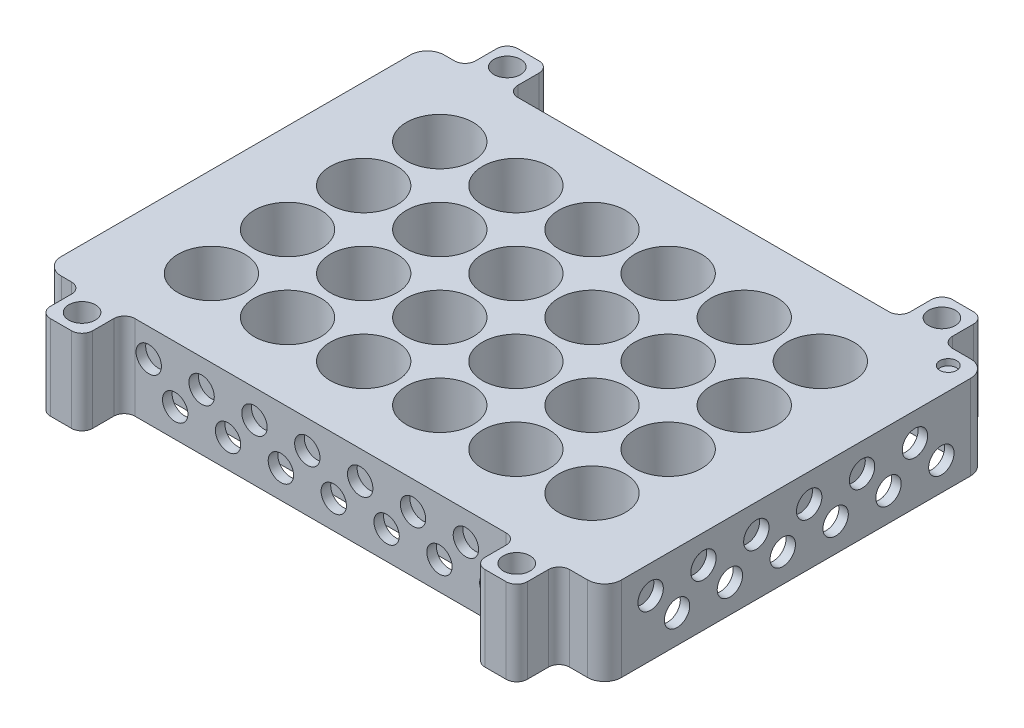
from build123d import *

# Parameters (mm, degrees)
SKETCH1_W           = 157.0786
SKETCH1_H           = 90.551
BOSS_EXTRUDE1_DEPTH = 24.5
CUT_EXTRUDE30_DEPTH = 24.5
CUT_EXTRUDE5_START  = -24.5
SKETCH7_R           = 7.895
CUT_EXTRUDE5_DEPTH  = 17
SKETCH23_W          = 128.6429
SKETCH23_H          = 86.72376579
SKETCH23_W_2        = 110.8429
SKETCH23_H_2        = 74.72376579
CUT_EXTRUDE21_DEPTH = 4.5
FILLET7_R           = 1
FILLET8_R           = 2.75
SKETCH26_W          = 115.8718073
SKETCH26_H          = 74.72376579
CUT_EXTRUDE22_DEPTH = 3
SKETCH29_W          = 12.30424
SKETCH29_H          = 90.551
CUT_EXTRUDE25_DEPTH = 183.957427231
FILLET9_R           = 4
SKETCH30_W          = 10
SKETCH30_H          = 10
BOSS_EXTRUDE2_DEPTH = 24.5
SKETCH31_R          = 3.15
CUT_EXTRUDE26_DEPTH = 178.961706315
FILLET10_R          = 2.5
SKETCH35_R          = 1.4
BOSS_EXTRUDE3_DEPTH = 0.75
SKETCH37_W          = 236.034585018
SKETCH37_H          = 147.923412956
CUT_EXTRUDE29_DEPTH = 4.5
SKETCH36_W          = 128
SKETCH36_H          = 85.994841346
SKETCH36_W_2        = 110.5
SKETCH36_H_2        = 75.89132888
CUT_EXTRUDE28_DEPTH = 17
FILLET11_R          = 4
FILLET12_R          = 4
SKETCH43_R          = 2
CUT_EXTRUDE32_DEPTH = 1.5
SKETCH44_R          = 3
CUT_EXTRUDE33_DEPTH = 2.23506
SKETCH45_R          = 3
CUT_EXTRUDE34_DEPTH = 2.278079327
CUT_EXTRUDE35_START = -2.23506
SKETCH46_R          = 3
CUT_EXTRUDE35_DEPTH = 2.23506
SKETCH47_R          = 3
CUT_EXTRUDE36_DEPTH = 2.278079327


with BuildPart() as part:
    # Sketch1 → Boss-Extrude1 (new body)
    with BuildSketch(Plane(origin=(0, 0, 0), x_dir=(1, 0, 0), z_dir=(0, 1, 0))):
        with Locations((78.5393, -45.2755)):
            Rectangle(SKETCH1_W, SKETCH1_H)
    extrude(amount=BOSS_EXTRUDE1_DEPTH)

    # Sketch39 → Cut-Extrude30 (cut)
    with BuildSketch(Plane(origin=(0, 24.5, 0), x_dir=(1, 0, 0), z_dir=(0, 1, 0))):
        Polygon((36.7043, -11.5955), (36.7043, -17.9255), (30.3743, -17.9255), (30.3743, -12.10434), (30.88314, -11.5955), align=None)
        Polygon((36.7043, -18.6255), (36.7043, -24.9555), (30.3743, -24.9555), (30.3743, -19.13434), (30.88314, -18.6255), align=None)
        Polygon((54.7043, -11.5955), (54.7043, -17.9255), (48.3743, -17.9255), (48.3743, -12.10434), (48.88314, -11.5955), align=None)
        Polygon((72.7043, -11.5955), (72.7043, -17.9255), (66.3743, -17.9255), (66.3743, -12.10434), (66.88314, -11.5955), align=None)
        Polygon((90.7043, -11.5955), (90.7043, -17.9255), (84.3743, -17.9255), (84.3743, -12.10434), (84.88314, -11.5955), align=None)
        Polygon((108.7043, -11.5955), (108.7043, -17.9255), (102.3743, -17.9255), (102.3743, -12.10434), (102.88314, -11.5955), align=None)
        Polygon((126.7043, -11.5955), (126.7043, -17.9255), (120.3743, -17.9255), (120.3743, -12.10434), (120.88314, -11.5955), align=None)
        Polygon((54.7043, -29.5955), (54.7043, -35.9255), (48.3743, -35.9255), (48.3743, -30.10434), (48.88314, -29.5955), align=None)
        Polygon((72.7043, -29.5955), (72.7043, -35.9255), (66.3743, -35.9255), (66.3743, -30.10434), (66.88314, -29.5955), align=None)
        Polygon((90.7043, -29.5955), (90.7043, -35.9255), (84.3743, -35.9255), (84.3743, -30.10434), (84.88314, -29.5955), align=None)
        Polygon((108.7043, -29.5955), (108.7043, -35.9255), (102.3743, -35.9255), (102.3743, -30.10434), (102.88314, -29.5955), align=None)
        Polygon((126.7043, -29.5955), (126.7043, -35.9255), (120.3743, -35.9255), (120.3743, -30.10434), (120.88314, -29.5955), align=None)
        Polygon((54.7043, -47.5955), (54.7043, -53.9255), (48.3743, -53.9255), (48.3743, -48.10434), (48.88314, -47.5955), align=None)
        Polygon((72.7043, -47.5955), (72.7043, -53.9255), (66.3743, -53.9255), (66.3743, -48.10434), (66.88314, -47.5955), align=None)
        Polygon((90.7043, -47.5955), (90.7043, -53.9255), (84.3743, -53.9255), (84.3743, -48.10434), (84.88314, -47.5955), align=None)
        Polygon((108.7043, -47.5955), (108.7043, -53.9255), (102.3743, -53.9255), (102.3743, -48.10434), (102.88314, -47.5955), align=None)
        Polygon((126.7043, -47.5955), (126.7043, -53.9255), (120.3743, -53.9255), (120.3743, -48.10434), (120.88314, -47.5955), align=None)
        Polygon((54.7043, -65.5955), (54.7043, -71.9255), (48.3743, -71.9255), (48.3743, -66.10434), (48.88314, -65.5955), align=None)
        Polygon((72.7043, -65.5955), (72.7043, -71.9255), (66.3743, -71.9255), (66.3743, -66.10434), (66.88314, -65.5955), align=None)
        Polygon((90.7043, -65.5955), (90.7043, -71.9255), (84.3743, -71.9255), (84.3743, -66.10434), (84.88314, -65.5955), align=None)
        Polygon((108.7043, -65.5955), (108.7043, -71.9255), (102.3743, -71.9255), (102.3743, -66.10434), (102.88314, -65.5955), align=None)
        Polygon((126.7043, -65.5955), (126.7043, -71.9255), (120.3743, -71.9255), (120.3743, -66.10434), (120.88314, -65.5955), align=None)
        Polygon((36.7043, -29.5955), (36.7043, -35.9255), (30.3743, -35.9255), (30.3743, -30.10434), (30.88314, -29.5955), align=None)
        Polygon((36.7043, -47.5955), (36.7043, -53.9255), (30.3743, -53.9255), (30.3743, -48.10434), (30.88314, -47.5955), align=None)
        Polygon((36.7043, -65.5955), (36.7043, -71.9255), (30.3743, -71.9255), (30.3743, -66.10434), (30.88314, -65.5955), align=None)
        Polygon((54.7043, -18.6255), (54.7043, -24.9555), (48.3743, -24.9555), (48.3743, -19.13434), (48.88314, -18.6255), align=None)
        Polygon((72.7043, -18.6255), (72.7043, -24.9555), (66.3743, -24.9555), (66.3743, -19.13434), (66.88314, -18.6255), align=None)
        Polygon((90.7043, -18.6255), (90.7043, -24.9555), (84.3743, -24.9555), (84.3743, -19.13434), (84.88314, -18.6255), align=None)
        Polygon((108.7043, -18.6255), (108.7043, -24.9555), (102.3743, -24.9555), (102.3743, -19.13434), (102.88314, -18.6255), align=None)
        Polygon((126.7043, -18.6255), (126.7043, -24.9555), (120.3743, -24.9555), (120.3743, -19.13434), (120.88314, -18.6255), align=None)
        Polygon((54.7043, -36.6255), (54.7043, -42.9555), (48.3743, -42.9555), (48.3743, -37.13434), (48.88314, -36.6255), align=None)
        Polygon((72.7043, -36.6255), (72.7043, -42.9555), (66.3743, -42.9555), (66.3743, -37.13434), (66.88314, -36.6255), align=None)
        Polygon((90.7043, -36.6255), (90.7043, -42.9555), (84.3743, -42.9555), (84.3743, -37.13434), (84.88314, -36.6255), align=None)
        Polygon((108.7043, -36.6255), (108.7043, -42.9555), (102.3743, -42.9555), (102.3743, -37.13434), (102.88314, -36.6255), align=None)
        Polygon((126.7043, -36.6255), (126.7043, -42.9555), (120.3743, -42.9555), (120.3743, -37.13434), (120.88314, -36.6255), align=None)
        Polygon((54.7043, -54.6255), (54.7043, -60.9555), (48.3743, -60.9555), (48.3743, -55.13434), (48.88314, -54.6255), align=None)
        Polygon((72.7043, -54.6255), (72.7043, -60.9555), (66.3743, -60.9555), (66.3743, -55.13434), (66.88314, -54.6255), align=None)
        Polygon((90.7043, -54.6255), (90.7043, -60.9555), (84.3743, -60.9555), (84.3743, -55.13434), (84.88314, -54.6255), align=None)
        Polygon((108.7043, -54.6255), (108.7043, -60.9555), (102.3743, -60.9555), (102.3743, -55.13434), (102.88314, -54.6255), align=None)
        Polygon((126.7043, -54.6255), (126.7043, -60.9555), (120.3743, -60.9555), (120.3743, -55.13434), (120.88314, -54.6255), align=None)
        Polygon((54.7043, -72.6255), (54.7043, -78.9555), (48.3743, -78.9555), (48.3743, -73.13434), (48.88314, -72.6255), align=None)
        Polygon((72.7043, -72.6255), (72.7043, -78.9555), (66.3743, -78.9555), (66.3743, -73.13434), (66.88314, -72.6255), align=None)
        Polygon((90.7043, -72.6255), (90.7043, -78.9555), (84.3743, -78.9555), (84.3743, -73.13434), (84.88314, -72.6255), align=None)
        Polygon((108.7043, -72.6255), (108.7043, -78.9555), (102.3743, -78.9555), (102.3743, -73.13434), (102.88314, -72.6255), align=None)
        Polygon((126.7043, -72.6255), (126.7043, -78.9555), (120.3743, -78.9555), (120.3743, -73.13434), (120.88314, -72.6255), align=None)
        Polygon((36.7043, -36.6255), (36.7043, -42.9555), (30.3743, -42.9555), (30.3743, -37.13434), (30.88314, -36.6255), align=None)
        Polygon((36.7043, -54.6255), (36.7043, -60.9555), (30.3743, -60.9555), (30.3743, -55.13434), (30.88314, -54.6255), align=None)
        Polygon((36.7043, -72.6255), (36.7043, -78.9555), (30.3743, -78.9555), (30.3743, -73.13434), (30.88314, -72.6255), align=None)
    extrude(amount=-CUT_EXTRUDE30_DEPTH, mode=Mode.SUBTRACT)

    # Sketch7 → Cut-Extrude5 (cut)
    with BuildSketch(Plane.XZ.offset(CUT_EXTRUDE5_START)):
        with Locations(Location((33.5393, 72.2755, 0), (0, 0, 90))):
            Circle(SKETCH7_R)
        with Locations(Location((51.5393, 72.2755, 0), (0, 0, 90))):
            Circle(SKETCH7_R)
        with Locations(Location((69.5393, 72.2755, 0), (0, 0, 90))):
            Circle(SKETCH7_R)
        with Locations(Location((87.5393, 72.2755, 0), (0, 0, 90))):
            Circle(SKETCH7_R)
        with Locations(Location((105.5393, 72.2755, 0), (0, 0, 90))):
            Circle(SKETCH7_R)
        with Locations(Location((123.5393, 72.2755, 0), (0, 0, 90))):
            Circle(SKETCH7_R)
        with Locations(Location((51.5393, 54.2755, 0), (0, 0, 90))):
            Circle(SKETCH7_R)
        with Locations(Location((69.5393, 54.2755, 0), (0, 0, 90))):
            Circle(SKETCH7_R)
        with Locations(Location((87.5393, 54.2755, 0), (0, 0, 90))):
            Circle(SKETCH7_R)
        with Locations(Location((105.5393, 54.2755, 0), (0, 0, 90))):
            Circle(SKETCH7_R)
        with Locations(Location((123.5393, 54.2755, 0), (0, 0, 90))):
            Circle(SKETCH7_R)
        with Locations(Location((51.5393, 36.2755, 0), (0, 0, 90))):
            Circle(SKETCH7_R)
        with Locations(Location((69.5393, 36.2755, 0), (0, 0, 90))):
            Circle(SKETCH7_R)
        with Locations(Location((87.5393, 36.2755, 0), (0, 0, 90))):
            Circle(SKETCH7_R)
        with Locations(Location((105.5393, 36.2755, 0), (0, 0, 90))):
            Circle(SKETCH7_R)
        with Locations(Location((123.5393, 36.2755, 0), (0, 0, 90))):
            Circle(SKETCH7_R)
        with Locations(Location((51.5393, 18.2755, 0), (0, 0, 90))):
            Circle(SKETCH7_R)
        with Locations(Location((69.5393, 18.2755, 0), (0, 0, 90))):
            Circle(SKETCH7_R)
        with Locations(Location((87.5393, 18.2755, 0), (0, 0, 90))):
            Circle(SKETCH7_R)
        with Locations(Location((105.5393, 18.2755, 0), (0, 0, 90))):
            Circle(SKETCH7_R)
        with Locations(Location((123.5393, 18.2755, 0), (0, 0, 90))):
            Circle(SKETCH7_R)
        with Locations(Location((33.5393, 54.2755, 0), (0, 0, 90))):
            Circle(SKETCH7_R)
        with Locations(Location((33.5393, 36.2755, 0), (0, 0, 90))):
            Circle(SKETCH7_R)
        with Locations(Location((33.5393, 18.2755, 0), (0, 0, 90))):
            Circle(SKETCH7_R)
    extrude(amount=CUT_EXTRUDE5_DEPTH, mode=Mode.SUBTRACT)

    # Sketch23 → Cut-Extrude21 (cut)
    with BuildSketch(Plane(origin=(0, 24.5, 0), x_dir=(1, 0, 0), z_dir=(0, 1, 0))):
        with Locations((78.5393, -45.275497105)):
            Rectangle(SKETCH23_W, SKETCH23_H)
        with Locations((78.5393, -45.275497105)):
            Rectangle(SKETCH23_W_2, SKETCH23_H_2, mode=Mode.SUBTRACT)
    extrude(amount=-CUT_EXTRUDE21_DEPTH, mode=Mode.SUBTRACT)

    # Fillet7
    fillet7_edges = [part.edges().sort_by_distance(p)[0] for p in [
        (133.96075, 22.25, 82.63738),
        (23.11785, 22.25, 82.63738),
        (23.11785, 22.25, 7.91361421),
        (133.96075, 22.25, 7.91361421),
    ]]
    fillet(fillet7_edges, radius=FILLET7_R)

    # Fillet8
    fillet8_edges = [part.edges().sort_by_distance(p)[0] for p in [
        (142.86075, 22.25, 1.91361421),
        (142.86075, 22.25, 88.63738),
        (14.21785, 22.25, 88.63738),
        (14.21785, 22.25, 1.91361421),
    ]]
    fillet(fillet8_edges, radius=FILLET8_R)

    # Sketch26 → Cut-Extrude22 (cut)
    with BuildSketch(Plane(origin=(0, 24.5, 0), x_dir=(1, 0, 0), z_dir=(0, 1, 0))):
        with Locations((76.02484635, -45.275497105)):
            Rectangle(SKETCH26_W, SKETCH26_H)
    extrude(amount=-CUT_EXTRUDE22_DEPTH, mode=Mode.SUBTRACT)

    # Sketch29 → Cut-Extrude25 (cut, through all)
    with BuildSketch(Plane(origin=(0, 24.5, 0), x_dir=(1, 0, 0), z_dir=(0, 1, 0))):
        with Locations((150.92648, -45.2755)):
            Rectangle(SKETCH29_W, SKETCH29_H)
        with Locations((6.15212, -45.2755)):
            Rectangle(SKETCH29_W, SKETCH29_H)
    extrude(amount=-CUT_EXTRUDE25_DEPTH, mode=Mode.SUBTRACT)

    # Fillet9
    fillet9_edges = [part.edges().sort_by_distance(p)[0] for p in [
        (144.77436, 12.25, 90.551),
        (144.77436, 12.25, 0),
        (12.30424, 12.25, 0),
        (12.30424, 12.25, 90.551),
    ]]
    fillet(fillet9_edges, radius=FILLET9_R)

    # Sketch30 → Boss-Extrude2 (add, through all)
    with BuildSketch(Plane.XZ):
        with Locations((129.0119, -5)):
            Rectangle(SKETCH30_W, SKETCH30_H)
        with Locations((26.2259, -5)):
            Rectangle(SKETCH30_W, SKETCH30_H)
        with Locations((129.0119, 95.551)):
            Rectangle(SKETCH30_W, SKETCH30_H)
        with Locations((26.2259, 95.551)):
            Rectangle(SKETCH30_W, SKETCH30_H)
    extrude(amount=-BOSS_EXTRUDE2_DEPTH)

    # Sketch31 → Cut-Extrude26 (cut, through all)
    with BuildSketch(Plane(origin=(0, 24.5, 0), x_dir=(1, 0, 0), z_dir=(0, 1, 0))):
        with Locations(Location((26.2259, 5, 0), (0, 0, 270))):
            Circle(SKETCH31_R)
        with Locations(Location((129.0119, 5, 0), (0, 0, 270))):
            Circle(SKETCH31_R)
        with Locations(Location((26.2259, -95.551, 0), (0, 0, 270))):
            Circle(SKETCH31_R)
        with Locations(Location((129.0119, -95.551, 0), (0, 0, 270))):
            Circle(SKETCH31_R)
    extrude(amount=-CUT_EXTRUDE26_DEPTH, mode=Mode.SUBTRACT)

    # Fillet10
    fillet10_edges = [part.edges().sort_by_distance(p)[0] for p in [
        (134.0119, 12.25, 0),
        (134.0119, 12.25, -10),
        (124.0119, 12.25, -10),
        (124.0119, 12.25, 0),
        (21.2259, 12.25, -10),
        (21.2259, 12.25, 0),
        (31.2259, 12.25, 0),
        (31.2259, 12.25, -10),
        (134.0119, 12.25, 100.551),
        (134.0119, 12.25, 90.551),
        (124.0119, 12.25, 90.551),
        (124.0119, 12.25, 100.551),
        (21.2259, 12.25, 90.551),
        (21.2259, 12.25, 100.551),
        (31.2259, 12.25, 100.551),
        (31.2259, 12.25, 90.551),
    ]]
    fillet(fillet10_edges, radius=FILLET10_R)

    # Sketch35 → Boss-Extrude3 (add)
    with BuildSketch(Plane(origin=(0, 21.5, 0), x_dir=(1, 0, 0), z_dir=(0, 1, 0))):
        with Locations(Location((114.5393, -27.2755, 0), (0, 0, 90))):
            Circle(SKETCH35_R)
        with Locations(Location((42.5393, -63.2755, 0), (0, 0, 90))):
            Circle(SKETCH35_R)
    extrude(amount=BOSS_EXTRUDE3_DEPTH)

    # Sketch37 → Cut-Extrude29 (cut)
    with BuildSketch(Plane(origin=(0, 24.5, 0), x_dir=(1, 0, 0), z_dir=(0, 1, 0))):
        with Locations((96.643531952, -44.613547987)):
            Rectangle(SKETCH37_W, SKETCH37_H)
    extrude(amount=-CUT_EXTRUDE29_DEPTH, mode=Mode.SUBTRACT)

    # Sketch36 → Cut-Extrude28 (cut)
    with BuildSketch(Plane.XZ):
        with Locations((78.5393, 45.2755)):
            Rectangle(SKETCH36_W, SKETCH36_H)
        with Locations((78.5393, 45.2755)):
            Rectangle(SKETCH36_W_2, SKETCH36_H_2, mode=Mode.SUBTRACT)
    extrude(amount=-CUT_EXTRUDE28_DEPTH, mode=Mode.SUBTRACT)

    # Fillet11
    fillet11_edges = [part.edges().sort_by_distance(p)[0] for p in [
        (23.2893, 8.5, 83.22116444),
        (133.7893, 8.5, 83.22116444),
        (133.7893, 8.5, 7.32983556),
        (23.2893, 8.5, 7.32983556),
    ]]
    fillet(fillet11_edges, radius=FILLET11_R)

    # Fillet12
    fillet12_edges = [part.edges().sort_by_distance(p)[0] for p in [
        (14.5393, 8.5, 2.278079327),
        (14.5393, 8.5, 88.272920673),
        (142.5393, 8.5, 88.272920673),
        (142.5393, 8.5, 2.278079327),
    ]]
    fillet(fillet12_edges, radius=FILLET12_R)

    # Sketch43 → Cut-Extrude32 (cut)
    with BuildSketch(Plane(origin=(0, 20, 0), x_dir=(1, 0, 0), z_dir=(0, 1, 0))):
        with Locations(Location((139.5119, -4, 0), (0, 0, 270))):
            Circle(SKETCH43_R)
    extrude(amount=-CUT_EXTRUDE32_DEPTH, mode=Mode.SUBTRACT)

    # Sketch44 → Cut-Extrude33 (cut)
    with BuildSketch(Plane.ZY.offset(-12.30424)):
        with Locations((10.9005, 6.666666667)):
            Circle(SKETCH44_R)
        with Locations((23.4005, 6.666666667)):
            Circle(SKETCH44_R)
        with Locations((35.9005, 6.666666667)):
            Circle(SKETCH44_R)
        with Locations((48.4005, 6.666666667)):
            Circle(SKETCH44_R)
        with Locations((60.9005, 6.666666667)):
            Circle(SKETCH44_R)
        with Locations((73.4005, 6.666666667)):
            Circle(SKETCH44_R)
        with Locations((17.1505, 13.333333333)):
            Circle(SKETCH44_R)
        with Locations((29.6505, 13.333333333)):
            Circle(SKETCH44_R)
        with Locations((42.1505, 13.333333333)):
            Circle(SKETCH44_R)
        with Locations((54.6505, 13.333333333)):
            Circle(SKETCH44_R)
        with Locations((67.1505, 13.333333333)):
            Circle(SKETCH44_R)
        with Locations((79.6505, 13.333333333)):
            Circle(SKETCH44_R)
    extrude(amount=-CUT_EXTRUDE33_DEPTH, mode=Mode.SUBTRACT)

    # Sketch45 → Cut-Extrude34 (cut)
    with BuildSketch(Plane.XY.offset(90.551)):
        with Locations((36.9939, 13.333333333)):
            Circle(SKETCH45_R)
        with Locations((49.4939, 13.333333333)):
            Circle(SKETCH45_R)
        with Locations((61.9939, 13.333333333)):
            Circle(SKETCH45_R)
        with Locations((74.4939, 13.333333333)):
            Circle(SKETCH45_R)
        with Locations((86.9939, 13.333333333)):
            Circle(SKETCH45_R)
        with Locations((99.4939, 13.333333333)):
            Circle(SKETCH45_R)
        with Locations((111.9939, 13.333333333)):
            Circle(SKETCH45_R)
        with Locations((43.2439, 6.666666667)):
            Circle(SKETCH45_R)
        with Locations((55.7439, 6.666666667)):
            Circle(SKETCH45_R)
        with Locations((68.2439, 6.666666667)):
            Circle(SKETCH45_R)
        with Locations((80.7439, 6.666666667)):
            Circle(SKETCH45_R)
        with Locations((93.2439, 6.666666667)):
            Circle(SKETCH45_R)
        with Locations((105.7439, 6.666666667)):
            Circle(SKETCH45_R)
        with Locations((118.2439, 6.666666667)):
            Circle(SKETCH45_R)
    extrude(amount=-CUT_EXTRUDE34_DEPTH, mode=Mode.SUBTRACT)

    # Sketch46 → Cut-Extrude35 (cut)
    with BuildSketch(Plane(origin=(144.77436, 0, 0), x_dir=(0, 0, -1), z_dir=(1, 0, 0)).offset(CUT_EXTRUDE35_START)):
        with Locations(Location((-79.6505, 13.333333333, 0), (0, 0, 180))):
            Circle(SKETCH46_R)
        with Locations(Location((-67.1505, 13.333333333, 0), (0, 0, 180))):
            Circle(SKETCH46_R)
        with Locations(Location((-54.6505, 13.333333333, 0), (0, 0, 180))):
            Circle(SKETCH46_R)
        with Locations(Location((-42.1505, 13.333333333, 0), (0, 0, 180))):
            Circle(SKETCH46_R)
        with Locations(Location((-29.6505, 13.333333333, 0), (0, 0, 180))):
            Circle(SKETCH46_R)
        with Locations(Location((-73.4005, 6.666666667, 0), (0, 0, 180))):
            Circle(SKETCH46_R)
        with Locations(Location((-17.1505, 13.333333333, 0), (0, 0, 180))):
            Circle(SKETCH46_R)
        with Locations(Location((-60.9005, 6.666666667, 0), (0, 0, 180))):
            Circle(SKETCH46_R)
        with Locations(Location((-48.4005, 6.666666667, 0), (0, 0, 180))):
            Circle(SKETCH46_R)
        with Locations(Location((-35.9005, 6.666666667, 0), (0, 0, 180))):
            Circle(SKETCH46_R)
        with Locations(Location((-23.4005, 6.666666667, 0), (0, 0, 180))):
            Circle(SKETCH46_R)
        with Locations(Location((-10.9005, 6.666666667, 0), (0, 0, 180))):
            Circle(SKETCH46_R)
    extrude(amount=CUT_EXTRUDE35_DEPTH, mode=Mode.SUBTRACT)

    # Sketch47 → Cut-Extrude36 (cut)
    with BuildSketch(Plane(origin=(0, 0, 0), x_dir=(-1, 0, 0), z_dir=(0, 0, -1))):
        with Locations((-118.2439, 13.333333333)):
            Circle(SKETCH47_R)
        with Locations((-43.2439, 13.333333333)):
            Circle(SKETCH47_R)
        with Locations((-80.7439, 13.333333333)):
            Circle(SKETCH47_R)
        with Locations((-68.2439, 13.333333333)):
            Circle(SKETCH47_R)
        with Locations((-55.7439, 13.333333333)):
            Circle(SKETCH47_R)
        with Locations((-93.2439, 13.333333333)):
            Circle(SKETCH47_R)
        with Locations((-105.7439, 13.333333333)):
            Circle(SKETCH47_R)
        with Locations((-111.9939, 6.666666667)):
            Circle(SKETCH47_R)
        with Locations((-99.4939, 6.666666667)):
            Circle(SKETCH47_R)
        with Locations((-86.9939, 6.666666667)):
            Circle(SKETCH47_R)
        with Locations((-74.4939, 6.666666667)):
            Circle(SKETCH47_R)
        with Locations((-61.9939, 6.666666667)):
            Circle(SKETCH47_R)
        with Locations((-49.4939, 6.666666667)):
            Circle(SKETCH47_R)
        with Locations((-36.9939, 6.666666667)):
            Circle(SKETCH47_R)
    extrude(amount=-CUT_EXTRUDE36_DEPTH, mode=Mode.SUBTRACT)


solid = part.part
